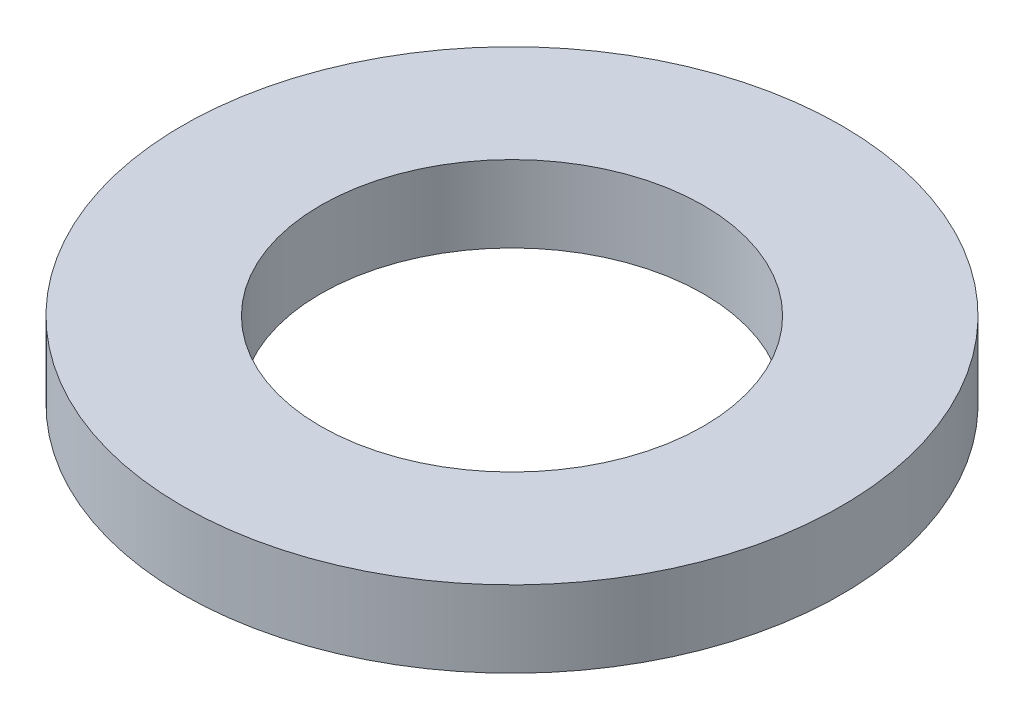
from build123d import *

# Parameters (mm, degrees)
SKETCH1_R           = 77.5
BOSS_EXTRUDE1_DEPTH = 18
SKETCH2_R           = 45
CUT_EXTRUDE1_DEPTH  = 112.069797875


with BuildPart() as part:
    # Sketch1 → Boss-Extrude1 (new body)
    with BuildSketch(Plane(origin=(0, 0, 0), x_dir=(1, 0, 0), z_dir=(0, 1, 0))):
        Circle(SKETCH1_R)
    extrude(amount=BOSS_EXTRUDE1_DEPTH)

    # Sketch2 → Cut-Extrude1 (cut, through all)
    with BuildSketch(Plane(origin=(0, 0, 0), x_dir=(1, 0, 0), z_dir=(0, 1, 0))):
        Circle(SKETCH2_R)
    extrude(amount=CUT_EXTRUDE1_DEPTH, mode=Mode.SUBTRACT)


solid = part.part
